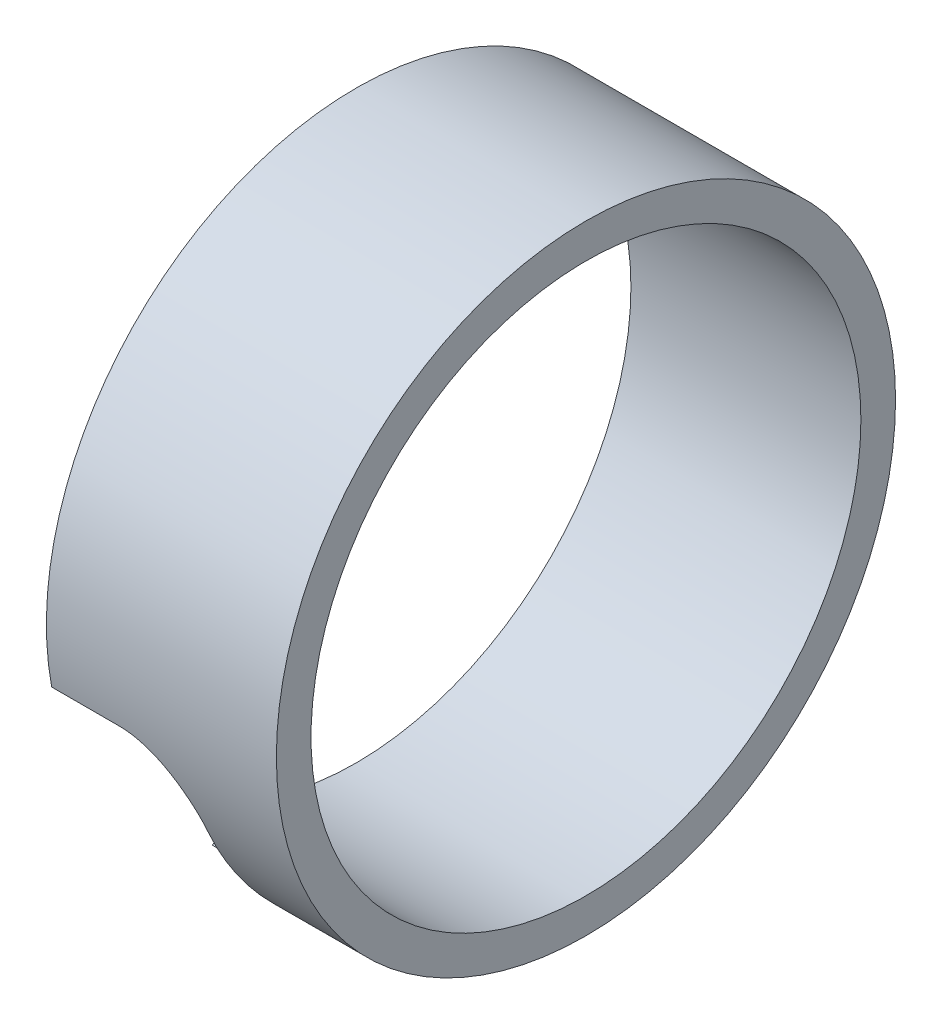
from build123d import *

# Parameters (mm, degrees)
SKETCH1_W          = 6.485999982
SKETCH1_H          = 0.977250014
CUT_EXTRUDE1_REACH = 42.92


with BuildPart() as part:
    # Sketch1 → Revolve1 (revolve)
    with BuildSketch(Plane.XY):
        with Locations((-35.769999961, 8.242624993)):
            Rectangle(SKETCH1_W, SKETCH1_H)
    revolve(axis=Axis((0, 0, 0), (-1, 0, 0)))

    # Sketch3 → Cut-Extrude1 (cut, up to next)
    with BuildSketch(Plane(origin=(0, 0, 0), x_dir=(1, 0, 0), z_dir=(0, -0.5944286428171203, 0.8041483623054868)), mode=Mode.PRIVATE) as cut_extrude1_sk1:
        with BuildLine():
            Line((-39.012999952, 3.81), (-39.012999952, -3.81))
            Line((-39.012999952, -3.81), (-37.107999952, -3.81))
            ThreePointArc((-37.107999952, -3.81), (-35.760961534, -3.252038418), (-35.202999952, -1.905))
            Line((-35.202999952, -1.905), (-35.202999952, 1.905))
            ThreePointArc((-35.202999952, 1.905), (-35.760961534, 3.252038418), (-37.107999952, 3.81))
            Line((-37.107999952, 3.81), (-39.012999952, 3.81))
        make_face()
    cut_extrude1_tool1 = extrude(cut_extrude1_sk1.sketch, amount=CUT_EXTRUDE1_REACH, mode=Mode.PRIVATE) & part.part
    add(cut_extrude1_tool1.solids().sort_by_distance((-37.191875, 0, 0))[0], mode=Mode.SUBTRACT)


solid = part.part
